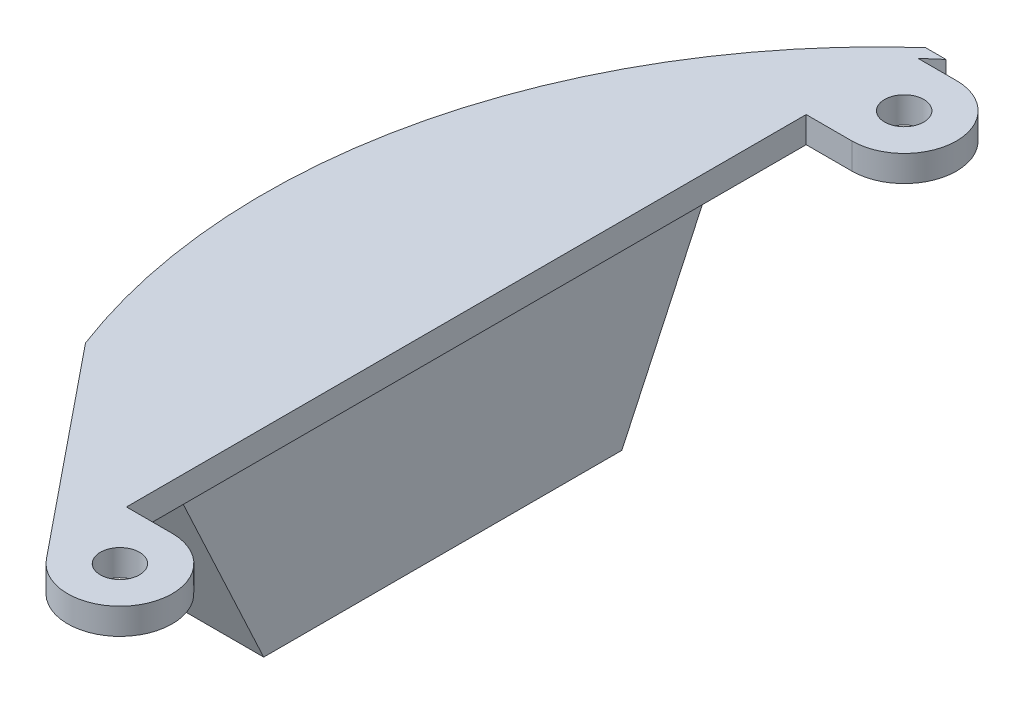
from build123d import *

# Parameters (mm, degrees)
SKETCH_1_W          = 20
SKETCH_1_H          = 70
SKETCH_1_R          = 1.5
SKETCH_1_W_2        = 6
SKETCH_1_H_2        = 52
EXTRUDE_1_DEPTH     = 2
SKETCH_2_W          = 0.5
SKETCH_2_H          = 26
CUT_EXTRUDE_1_DEPTH = 37.455452267
EXTRUDE_3_DEPTH     = 2
SKETCH_4_W          = 11.4
SKETCH_4_H          = 27.4
SKETCH_4_W_2        = 9
SKETCH_4_H_2        = 25
EXTRUDE_4_DEPTH     = 15
DRAFT_START         = -16.7
DRAFT_1_DEPTH       = 11.4
DRAFT_START_2       = -13.235626686
DRAFT_1_2_DEPTH     = 13.235626686


with BuildPart() as part:
    # Эскиз1 → Бобышка-Вытянуть1 (new body)
    with BuildSketch(Plane(origin=(0, 0, 0), x_dir=(1, 0, 0), z_dir=(0, 1, 0))):
        Rectangle(SKETCH_1_W, SKETCH_1_H)
        with Locations(Location((0, 30, 0), (0, 0, 270))):
            Circle(SKETCH_1_R, mode=Mode.SUBTRACT)
        with Locations(Location((0, -30, 0), (0, 0, 270))):
            Circle(SKETCH_1_R, mode=Mode.SUBTRACT)
        Rectangle(SKETCH_1_W_2, SKETCH_1_H_2, mode=Mode.SUBTRACT)
    extrude(amount=EXTRUDE_1_DEPTH)

    # Эскиз2 → Вырез-Вытянуть1 (cut, through all)
    with BuildSketch(Plane(origin=(0, 2, 0), x_dir=(1, 0, 0), z_dir=(0, 1, 0))):
        with Locations((-3.25, -13)):
            Rectangle(SKETCH_2_W, SKETCH_2_H)
        with Locations((-3.25, 13)):
            Rectangle(SKETCH_2_W, SKETCH_2_H)
        with BuildLine():
            ThreePointArc((4, 30), (2.828427125, 27.171572875), (0, 26))
            Line((0, 26), (3, 26))
            Line((3, 26), (3, 0))
            Line((3, 0), (10, 0))
            Line((10, 0), (10, 35))
            Line((10, 35), (-1.801814511, 35))
            ThreePointArc((-1.801814511, 35), (-2.371833534, 34.50465844), (-2.933620688, 34))
            Line((-2.933620688, 34), (0, 34))
            ThreePointArc((0, 34), (2.828427125, 32.828427125), (4, 30))
        make_face()
        with BuildLine():
            ThreePointArc((-10, 27.658633372), (-7.367393186, 30.953957731), (-4.449961479, 34))
            ThreePointArc((-4.449961479, 34), (-3.913284985, 34.504235123), (-3.368774283, 35))
            Line((-3.368774283, 35), (-10, 35))
            Line((-10, 35), (-10, 27.658633372))
        make_face()
        with BuildLine():
            Line((10, 0), (3, 0))
            Line((3, 0), (3, -26))
            Line((3, -26), (0, -26))
            ThreePointArc((0, -26), (2.828427125, -27.171572875), (4, -30))
            ThreePointArc((4, -30), (1.336481718, -33.770121565), (-3.106908308, -32.519349274))
            Line((-3.106908308, -32.519349274), (-4.5, -30.80136273))
            Line((-4.5, -30.80136273), (-4.5, -32.5))
            ThreePointArc((-4.5, -32.5), (-3.175976694, -33.777056798), (-1.801814511, -35))
            Line((-1.801814511, -35), (10, -35))
            Line((10, -35), (10, 0))
        make_face()
        with BuildLine():
            Line((-4.5, -32.5), (-4.5, -30.80136273))
            Line((-4.5, -30.80136273), (-10, -24.018660595))
            Line((-10, -24.018660595), (-10, -35))
            Line((-10, -35), (-1.801814511, -35))
            ThreePointArc((-1.801814511, -35), (-3.175976694, -33.777056798), (-4.5, -32.5))
        make_face()
    extrude(amount=-CUT_EXTRUDE_1_DEPTH, mode=Mode.SUBTRACT)

    # Эскиз3 → Бобышка-Вытянуть3 (add)
    with BuildSketch(Plane(origin=(0, 2, 0), x_dir=(1, 0, 0), z_dir=(0, 1, 0))):
        with BuildLine():
            Line((-15.931618932, -16.703677979), (-10, -24.018660595))
            Line((-10, -24.018660595), (-10, 27.658633372))
            ThreePointArc((-10, 27.658633372), (-18.585418451, 6.228867289), (-15.931618932, -16.703677979))
        make_face()
    extrude(amount=-EXTRUDE_3_DEPTH)

    # Эскиз4 → Бобышка-Вытянуть4 (add)
    with BuildSketch(Plane.XZ):
        with Locations((-11, 0)):
            Rectangle(SKETCH_4_W, SKETCH_4_H)
        with Locations((-11, 0)):
            Rectangle(SKETCH_4_W_2, SKETCH_4_H_2, mode=Mode.SUBTRACT)
    extrude(amount=EXTRUDE_4_DEPTH)

    # Уклон1: read off the stored shape, not the designer's step
    # Уклон1 outline → Уклон1 (add)
    with BuildSketch(Plane.YZ.offset(DRAFT_START)):
        Polygon((0, 13.7), (0, 20.694614872), (-15, 13.7), align=None)
        Polygon((0, -20.694614872), (0, -13.7), (-15, -13.7), align=None)
    extrude(amount=DRAFT_1_DEPTH)

    # Draft 1 2 outline → Draft 1 2 (cut)
    with BuildSketch(Plane(origin=(0, 0, 0), x_dir=(1, 0, 0), z_dir=(0, 1, 0)).offset(DRAFT_START_2)):
        with BuildLine():
            Line((-11.63690415, -22), (-15.931618932, -16.703677979))
            ThreePointArc((-15.931618932, -16.703677979), (-16.329223887, -15.617935511), (-16.7, -14.522740789))
            Line((-16.7, -14.522740789), (-16.7, -22))
            Line((-16.7, -22), (-11.63690415, -22))
        make_face()
        with BuildLine():
            Line((-16.7, 22), (-16.7, 14.522740788))
            ThreePointArc((-16.7, 14.522740788), (-15.2783441, 18.329891761), (-13.533119315, 22))
            Line((-13.533119315, 22), (-16.7, 22))
        make_face()
    extrude(amount=DRAFT_1_2_DEPTH, mode=Mode.SUBTRACT)


solid = part.part
